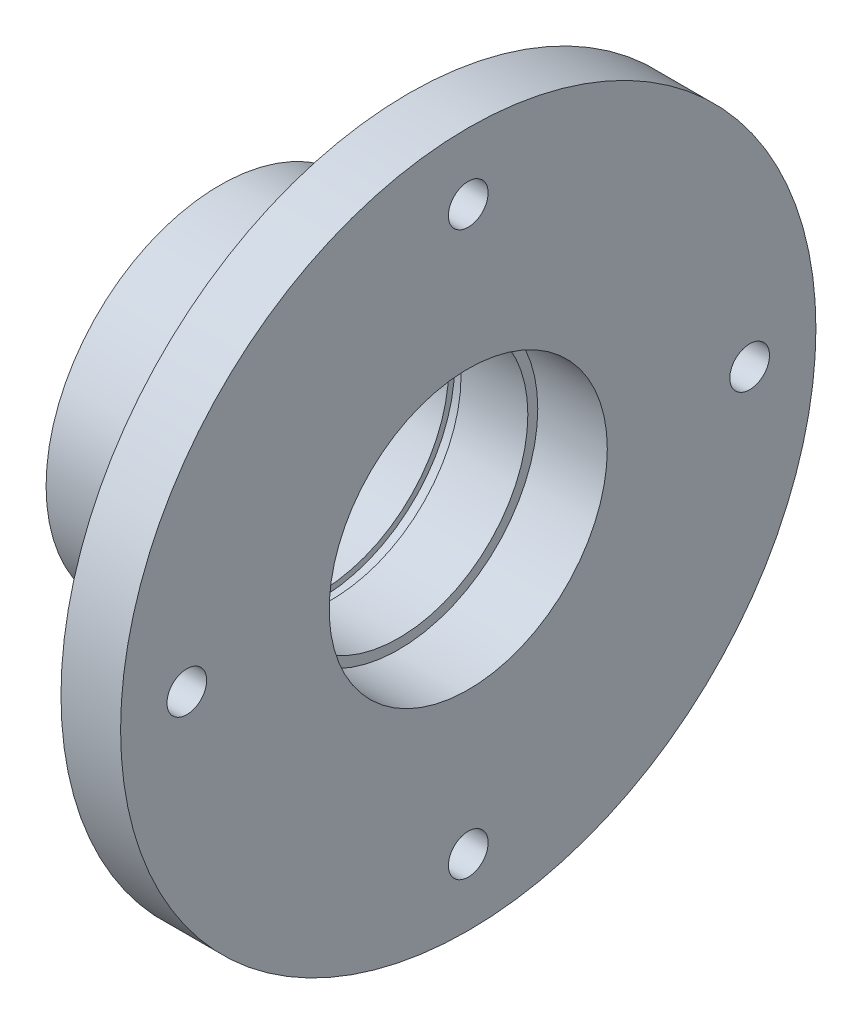
from build123d import *

# Parameters (mm, degrees)
SKETCH1_R           = 35
BOSS_EXTRUDE1_DEPTH = 25
CUT_EXTRUDE1_START  = -19
SKETCH2_R           = 35
SKETCH2_R_2         = 17.5
CUT_EXTRUDE1_DEPTH  = 19
SKETCH3_R           = 2
CUT_EXTRUDE2_DEPTH  = 18
SKETCH4_R           = 5.5
CUT_EXTRUDE4_DEPTH  = 3
CUT_EXTRUDE5_REACH  = 57.453
SKETCH5_R           = 9.5
SKETCH6_R           = 13
CUT_EXTRUDE6_DEPTH  = 20
CUT_EXTRUDE7_REACH  = 69.869
SKETCH7_R           = 2.5
SKETCH8_R           = 14
CUT_EXTRUDE8_DEPTH  = 7
SKETCH9_R           = 13.6
CUT_EXTRUDE9_DEPTH  = 0.625


with BuildPart() as part:
    # Sketch1 → Boss-Extrude1 (new body)
    with BuildSketch(Plane(origin=(0, 0, 0), x_dir=(0, 0, -1), z_dir=(1, 0, 0))):
        Circle(SKETCH1_R)
    extrude(amount=-BOSS_EXTRUDE1_DEPTH)

    # Sketch2 → Cut-Extrude1 (cut)
    with BuildSketch(Plane.ZY.offset(25).offset(CUT_EXTRUDE1_START)):
        Circle(SKETCH2_R)
        Circle(SKETCH2_R_2, mode=Mode.SUBTRACT)
    extrude(amount=CUT_EXTRUDE1_DEPTH, mode=Mode.SUBTRACT)

    # Sketch3 → Cut-Extrude2 (cut)
    with BuildSketch(Plane.ZY.offset(6)):
        with Locations((0, 28.33)):
            Circle(SKETCH3_R)
        with Locations((28.33, 0)):
            Circle(SKETCH3_R)
        with Locations((0, -28.33)):
            Circle(SKETCH3_R)
        with Locations((-28.33, 0)):
            Circle(SKETCH3_R)
    extrude(amount=-CUT_EXTRUDE2_DEPTH, mode=Mode.SUBTRACT)

    # Sketch4 → Cut-Extrude4 (cut)
    with BuildSketch(Plane.ZY.offset(6)):
        with Locations((0, 28.33)):
            Circle(SKETCH4_R)
        with Locations((28.33, 0)):
            Circle(SKETCH4_R)
        with Locations((0, -28.33)):
            Circle(SKETCH4_R)
        with Locations((-28.33, 0)):
            Circle(SKETCH4_R)
    extrude(amount=-CUT_EXTRUDE4_DEPTH, mode=Mode.SUBTRACT)

    # Sketch5 → Cut-Extrude5 (cut, up to next)
    with BuildSketch(Plane.ZY.offset(25), mode=Mode.PRIVATE) as cut_extrude5_sk1:
        Circle(SKETCH5_R)
    cut_extrude5_tool1 = extrude(cut_extrude5_sk1.sketch, amount=-CUT_EXTRUDE5_REACH, mode=Mode.PRIVATE) & part.part
    add(cut_extrude5_tool1.solids().sort_by_distance((-25, 0, 0))[0], mode=Mode.SUBTRACT)

    # Sketch6 → Cut-Extrude6 (cut)
    with BuildSketch(Plane(origin=(0, 0, 0), x_dir=(0, 0, -1), z_dir=(1, 0, 0))):
        Circle(SKETCH6_R)
    extrude(amount=-CUT_EXTRUDE6_DEPTH, mode=Mode.SUBTRACT)

    # Sketch7 → Cut-Extrude7 (cut, up to next)
    with BuildSketch(Plane(origin=(0, 17.5, 0), x_dir=(1, 0, 0), z_dir=(0, 1, 0)), mode=Mode.PRIVATE) as cut_extrude7_sk1:
        with Locations((-10, 0)):
            Circle(SKETCH7_R)
    cut_extrude7_tool1 = extrude(cut_extrude7_sk1.sketch, amount=-CUT_EXTRUDE7_REACH, mode=Mode.PRIVATE) & part.part
    add(cut_extrude7_tool1.solids().sort_by_distance((-10, 17.5, 0))[0], mode=Mode.SUBTRACT)

    # Sketch8 → Cut-Extrude8 (cut)
    with BuildSketch(Plane(origin=(0, 0, 0), x_dir=(0, 0, -1), z_dir=(1, 0, 0))):
        Circle(SKETCH8_R)
    extrude(amount=-CUT_EXTRUDE8_DEPTH, mode=Mode.SUBTRACT)

    # Sketch9 → Cut-Extrude9 (cut, symmetric)
    with BuildSketch(Plane(origin=(-14.35, 0, 0), x_dir=(0, 0, -1), z_dir=(1, 0, 0))):
        Circle(SKETCH9_R)
    extrude(amount=CUT_EXTRUDE9_DEPTH, both=True, mode=Mode.SUBTRACT)


solid = part.part
